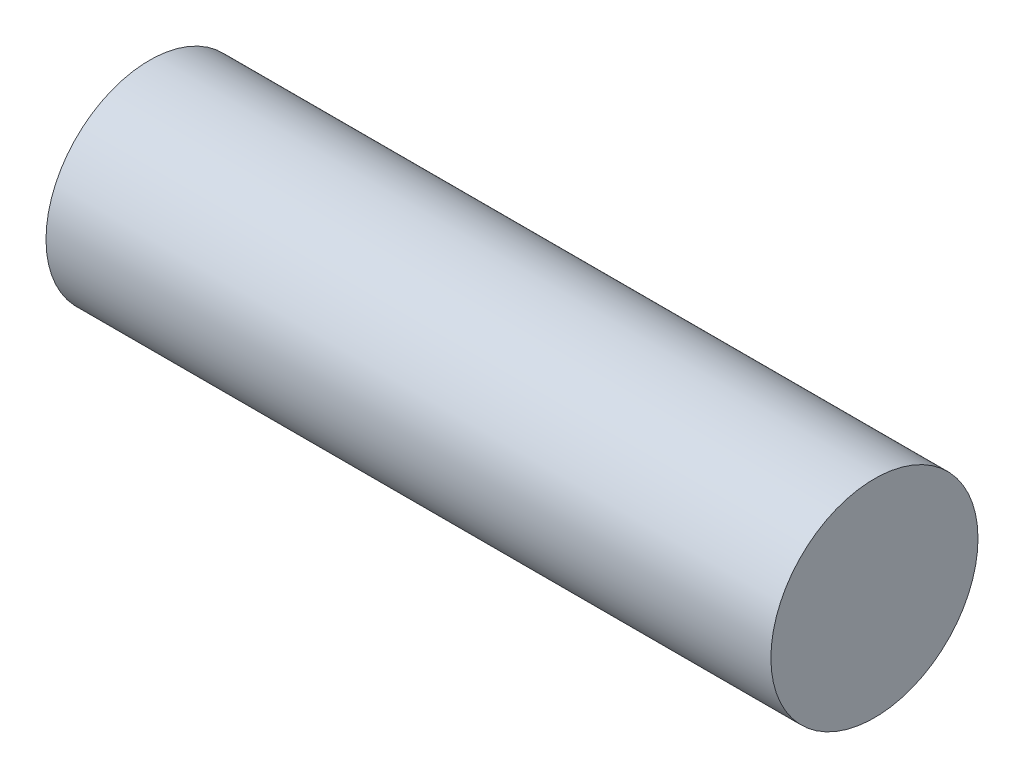
from build123d import *

# Parameters (mm, degrees)
SKETCH1_R           = 25.4
BOSS_EXTRUDE1_DEPTH = 177.8


with BuildPart() as part:
    # Sketch1 → Boss-Extrude1 (new body)
    with BuildSketch(Plane(origin=(0, 0, 0), x_dir=(0, 0, -1), z_dir=(1, 0, 0))):
        Circle(SKETCH1_R)
    extrude(amount=BOSS_EXTRUDE1_DEPTH)


solid = part.part
